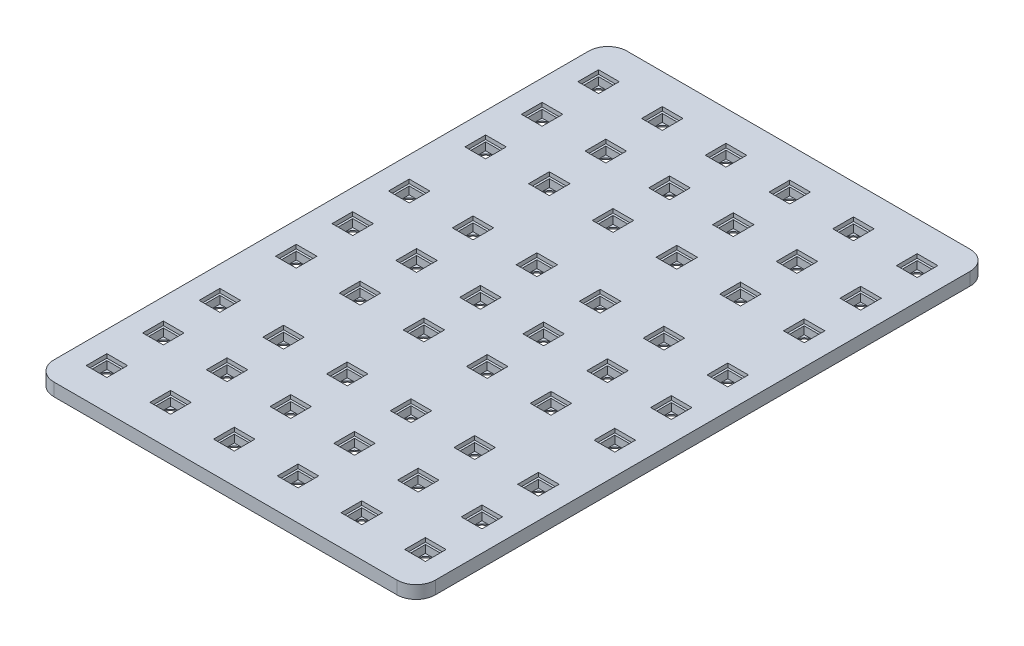
from build123d import *
from build123d.topology import SkipClean

# Parameters (mm, degrees)
SKETCH1_W            = 298.5
SKETCH1_H            = 448.5
BOSS_EXTRUDE1_DEPTH  = 20.1
SKETCH2_W            = 32.4
SKETCH2_H            = 32.4
SKETCH2_W_2          = 26
SKETCH2_H_2          = 26
CUT_EXTRUDE1_DEPTH   = 6.2
SKETCH2_3_W          = 26
SKETCH2_3_H          = 26
SKETCH2_3_R          = 12.5
CUT_EXTRUDE2_DEPTH   = 18.2
SKETCH2_4_R          = 12.5
CUT_EXTRUDE3_DEPTH   = 271.125220962
FILLET1_R            = 30
SHELL1_OUTLINE_W     = 36.4
SHELL1_OUTLINE_H     = 36.4
SHELL1_DEPTH         = 18.1
SHELL1_2_OUTLINE_W   = 36.4
SHELL1_2_OUTLINE_H   = 36.4
SHELL1_2_OUTLINE_W_2 = 30
SHELL1_2_OUTLINE_H_2 = 30
SHELL1_2_DEPTH       = 11.9


# Read off the part's stored shape, not the designer's step: Shell1
with BuildPart() as part:
    # Sketch1 → Boss-Extrude1 (new body)
    with BuildSketch(Plane(origin=(0, 0, 0), x_dir=(1, 0, 0), z_dir=(0, 1, 0))):
        Rectangle(SKETCH1_W, SKETCH1_H)
    extrude(amount=BOSS_EXTRUDE1_DEPTH)

    # Sketch2 → Cut-Extrude1 (cut)
    # profile 1 of 15: a face of its own
    with BuildSketch(Plane(origin=(0, 20.1, 0), x_dir=(1, 0, 0), z_dir=(0, 1, 0))):
        with Locations((-100.05, -160.55)):
            Rectangle(SKETCH2_W, SKETCH2_H)
        with Locations((-100.05, -160.55)):
            Rectangle(SKETCH2_W_2, SKETCH2_H_2, mode=Mode.SUBTRACT)
    # profile 2 of 15: a face of its own
    with BuildSketch(Plane(origin=(0, 20.1, 0), x_dir=(1, 0, 0), z_dir=(0, 1, 0))):
        with Locations((-0.35, -160.55)):
            Rectangle(SKETCH2_W, SKETCH2_H)
        with Locations((-0.35, -160.55)):
            Rectangle(SKETCH2_W_2, SKETCH2_H_2, mode=Mode.SUBTRACT)
    # profile 3 of 15: a face of its own
    with BuildSketch(Plane(origin=(0, 20.1, 0), x_dir=(1, 0, 0), z_dir=(0, 1, 0))):
        with Locations((99.35, -160.55)):
            Rectangle(SKETCH2_W, SKETCH2_H)
        with Locations((99.35, -160.55)):
            Rectangle(SKETCH2_W_2, SKETCH2_H_2, mode=Mode.SUBTRACT)
    # profile 4 of 15: a face of its own
    with BuildSketch(Plane(origin=(0, 20.1, 0), x_dir=(1, 0, 0), z_dir=(0, 1, 0))):
        with Locations((99.35, -72.15)):
            Rectangle(SKETCH2_W, SKETCH2_H)
        with Locations((99.35, -72.15)):
            Rectangle(SKETCH2_W_2, SKETCH2_H_2, mode=Mode.SUBTRACT)
    # profile 5 of 15: a face of its own
    with BuildSketch(Plane(origin=(0, 20.1, 0), x_dir=(1, 0, 0), z_dir=(0, 1, 0))):
        with Locations((-0.35, -72.15)):
            Rectangle(SKETCH2_W, SKETCH2_H)
        with Locations((-0.35, -72.15)):
            Rectangle(SKETCH2_W_2, SKETCH2_H_2, mode=Mode.SUBTRACT)
    # profile 6 of 15: a face of its own
    with BuildSketch(Plane(origin=(0, 20.1, 0), x_dir=(1, 0, 0), z_dir=(0, 1, 0))):
        with Locations((-100.05, -72.15)):
            Rectangle(SKETCH2_W, SKETCH2_H)
        with Locations((-100.05, -72.15)):
            Rectangle(SKETCH2_W_2, SKETCH2_H_2, mode=Mode.SUBTRACT)
    # profile 7 of 15: a face of its own
    with BuildSketch(Plane(origin=(0, 20.1, 0), x_dir=(1, 0, 0), z_dir=(0, 1, 0))):
        with Locations((-100.05, 16.25)):
            Rectangle(SKETCH2_W, SKETCH2_H)
        with Locations((-100.05, 16.25)):
            Rectangle(SKETCH2_W_2, SKETCH2_H_2, mode=Mode.SUBTRACT)
    # profile 8 of 15: a face of its own
    with BuildSketch(Plane(origin=(0, 20.1, 0), x_dir=(1, 0, 0), z_dir=(0, 1, 0))):
        with Locations((-0.35, 16.25)):
            Rectangle(SKETCH2_W, SKETCH2_H)
        with Locations((-0.35, 16.25)):
            Rectangle(SKETCH2_W_2, SKETCH2_H_2, mode=Mode.SUBTRACT)
    # profile 9 of 15: a face of its own
    with BuildSketch(Plane(origin=(0, 20.1, 0), x_dir=(1, 0, 0), z_dir=(0, 1, 0))):
        with Locations((99.35, 16.25)):
            Rectangle(SKETCH2_W, SKETCH2_H)
        with Locations((99.35, 16.25)):
            Rectangle(SKETCH2_W_2, SKETCH2_H_2, mode=Mode.SUBTRACT)
    # profile 10 of 15: a face of its own
    with BuildSketch(Plane(origin=(0, 20.1, 0), x_dir=(1, 0, 0), z_dir=(0, 1, 0))):
        with Locations((99.75, 135.85)):
            Rectangle(SKETCH2_W, SKETCH2_H)
        with Locations((99.75, 135.85)):
            Rectangle(SKETCH2_W_2, SKETCH2_H_2, mode=Mode.SUBTRACT)
    # profile 11 of 15: a face of its own
    with BuildSketch(Plane(origin=(0, 20.1, 0), x_dir=(1, 0, 0), z_dir=(0, 1, 0))):
        with Locations((-0.15, 135.85)):
            Rectangle(SKETCH2_W, SKETCH2_H)
        with Locations((-0.15, 135.85)):
            Rectangle(SKETCH2_W_2, SKETCH2_H_2, mode=Mode.SUBTRACT)
    # profile 12 of 15: a face of its own
    with BuildSketch(Plane(origin=(0, 20.1, 0), x_dir=(1, 0, 0), z_dir=(0, 1, 0))):
        with Locations((-100.05, 135.85)):
            Rectangle(SKETCH2_W, SKETCH2_H)
        with Locations((-100.05, 135.85)):
            Rectangle(SKETCH2_W_2, SKETCH2_H_2, mode=Mode.SUBTRACT)
    # profile 13 of 15: a face of its own
    with BuildSketch(Plane(origin=(0, 20.1, 0), x_dir=(1, 0, 0), z_dir=(0, 1, 0))):
        Polygon((-83.85, 208.05), (-83.85, 224.25), (-87.05, 224.25), (-87.05, 211.25), (-113.05, 211.25), (-113.05, 224.25), (-116.25, 224.25), (-116.25, 208.05), align=None)
    # profile 14 of 15: a face of its own
    with BuildSketch(Plane(origin=(0, 20.1, 0), x_dir=(1, 0, 0), z_dir=(0, 1, 0))):
        Polygon((-13.15, 224.25), (-16.35, 224.25), (-16.35, 208.05), (16.05, 208.05), (16.05, 224.25), (12.85, 224.25), (12.85, 211.25), (-13.15, 211.25), align=None)
    # profile 15 of 15: a face of its own
    with BuildSketch(Plane(origin=(0, 20.1, 0), x_dir=(1, 0, 0), z_dir=(0, 1, 0))):
        Polygon((86.75, 224.25), (83.55, 224.25), (83.55, 208.05), (115.95, 208.05), (115.95, 224.25), (112.75, 224.25), (112.75, 211.25), (86.75, 211.25), align=None)
    extrude(amount=-CUT_EXTRUDE1_DEPTH, mode=Mode.SUBTRACT)

    # Sketch2<3> → Cut-Extrude2 (cut)
    # profile 1 of 15: a face of its own
    with BuildSketch(Plane(origin=(0, 20.1, 0), x_dir=(1, 0, 0), z_dir=(0, 1, 0))):
        with Locations((-100.05, -160.55)):
            Rectangle(SKETCH2_3_W, SKETCH2_3_H)
        with Locations(Location((-100.05, -160.55, 0), (0, 0, 270))):
            Circle(SKETCH2_3_R, mode=Mode.SUBTRACT)
    # profile 2 of 15: a face of its own
    with BuildSketch(Plane(origin=(0, 20.1, 0), x_dir=(1, 0, 0), z_dir=(0, 1, 0))):
        with Locations((-0.35, -160.55)):
            Rectangle(SKETCH2_3_W, SKETCH2_3_H)
        with Locations(Location((-0.35, -160.55, 0), (0, 0, 270))):
            Circle(SKETCH2_3_R, mode=Mode.SUBTRACT)
    # profile 3 of 15: a face of its own
    with BuildSketch(Plane(origin=(0, 20.1, 0), x_dir=(1, 0, 0), z_dir=(0, 1, 0))):
        with Locations((99.35, -160.55)):
            Rectangle(SKETCH2_3_W, SKETCH2_3_H)
        with Locations(Location((99.35, -160.55, 0), (0, 0, 270))):
            Circle(SKETCH2_3_R, mode=Mode.SUBTRACT)
    # profile 4 of 15: a face of its own
    with BuildSketch(Plane(origin=(0, 20.1, 0), x_dir=(1, 0, 0), z_dir=(0, 1, 0))):
        with Locations((99.35, -72.15)):
            Rectangle(SKETCH2_3_W, SKETCH2_3_H)
        with Locations(Location((99.35, -72.15, 0), (0, 0, 270))):
            Circle(SKETCH2_3_R, mode=Mode.SUBTRACT)
    # profile 5 of 15: a face of its own
    with BuildSketch(Plane(origin=(0, 20.1, 0), x_dir=(1, 0, 0), z_dir=(0, 1, 0))):
        with Locations((-0.35, -72.15)):
            Rectangle(SKETCH2_3_W, SKETCH2_3_H)
        with Locations(Location((-0.35, -72.15, 0), (0, 0, 270))):
            Circle(SKETCH2_3_R, mode=Mode.SUBTRACT)
    # profile 6 of 15: a face of its own
    with BuildSketch(Plane(origin=(0, 20.1, 0), x_dir=(1, 0, 0), z_dir=(0, 1, 0))):
        with Locations((-100.05, -72.15)):
            Rectangle(SKETCH2_3_W, SKETCH2_3_H)
        with Locations(Location((-100.05, -72.15, 0), (0, 0, 270))):
            Circle(SKETCH2_3_R, mode=Mode.SUBTRACT)
    # profile 7 of 15: a face of its own
    with BuildSketch(Plane(origin=(0, 20.1, 0), x_dir=(1, 0, 0), z_dir=(0, 1, 0))):
        with Locations((-100.05, 135.85)):
            Rectangle(SKETCH2_3_W, SKETCH2_3_H)
        with Locations(Location((-100.05, 135.85, 0), (0, 0, 270))):
            Circle(SKETCH2_3_R, mode=Mode.SUBTRACT)
    # profile 8 of 15: a face of its own
    with BuildSketch(Plane(origin=(0, 20.1, 0), x_dir=(1, 0, 0), z_dir=(0, 1, 0))):
        with BuildLine():
            Line((-87.05, 211.25), (-87.05, 224.25))
            Line((-87.05, 224.25), (-87.55, 224.25))
            ThreePointArc((-87.55, 224.25), (-100.05, 211.75), (-112.55, 224.25))
            Line((-112.55, 224.25), (-113.05, 224.25))
            Line((-113.05, 224.25), (-113.05, 211.25))
            Line((-113.05, 211.25), (-87.05, 211.25))
        make_face()
    # profile 9 of 15: a face of its own
    with BuildSketch(Plane(origin=(0, 20.1, 0), x_dir=(1, 0, 0), z_dir=(0, 1, 0))):
        with BuildLine():
            Line((-12.65, 224.25), (-13.15, 224.25))
            Line((-13.15, 224.25), (-13.15, 211.25))
            Line((-13.15, 211.25), (12.85, 211.25))
            Line((12.85, 211.25), (12.85, 224.25))
            Line((12.85, 224.25), (12.35, 224.25))
            ThreePointArc((12.35, 224.25), (-0.15, 211.75), (-12.65, 224.25))
        make_face()
    # profile 10 of 15: a face of its own
    with BuildSketch(Plane(origin=(0, 20.1, 0), x_dir=(1, 0, 0), z_dir=(0, 1, 0))):
        with Locations((-0.15, 135.85)):
            Rectangle(SKETCH2_3_W, SKETCH2_3_H)
        with Locations(Location((-0.15, 135.85, 0), (0, 0, 270))):
            Circle(SKETCH2_3_R, mode=Mode.SUBTRACT)
    # profile 11 of 15: a face of its own
    with BuildSketch(Plane(origin=(0, 20.1, 0), x_dir=(1, 0, 0), z_dir=(0, 1, 0))):
        with Locations((99.75, 135.85)):
            Rectangle(SKETCH2_3_W, SKETCH2_3_H)
        with Locations(Location((99.75, 135.85, 0), (0, 0, 270))):
            Circle(SKETCH2_3_R, mode=Mode.SUBTRACT)
    # profile 12 of 15: a face of its own
    with BuildSketch(Plane(origin=(0, 20.1, 0), x_dir=(1, 0, 0), z_dir=(0, 1, 0))):
        with BuildLine():
            Line((87.25, 224.25), (86.75, 224.25))
            Line((86.75, 224.25), (86.75, 211.25))
            Line((86.75, 211.25), (112.75, 211.25))
            Line((112.75, 211.25), (112.75, 224.25))
            Line((112.75, 224.25), (112.25, 224.25))
            ThreePointArc((112.25, 224.25), (99.75, 211.75), (87.25, 224.25))
        make_face()
    # profile 13 of 15: a face of its own
    with BuildSketch(Plane(origin=(0, 20.1, 0), x_dir=(1, 0, 0), z_dir=(0, 1, 0))):
        with Locations((99.35, 16.25)):
            Rectangle(SKETCH2_3_W, SKETCH2_3_H)
        with Locations(Location((99.35, 16.25, 0), (0, 0, 270))):
            Circle(SKETCH2_3_R, mode=Mode.SUBTRACT)
    # profile 14 of 15: a face of its own
    with BuildSketch(Plane(origin=(0, 20.1, 0), x_dir=(1, 0, 0), z_dir=(0, 1, 0))):
        with Locations((-0.35, 16.25)):
            Rectangle(SKETCH2_3_W, SKETCH2_3_H)
        with Locations(Location((-0.35, 16.25, 0), (0, 0, 270))):
            Circle(SKETCH2_3_R, mode=Mode.SUBTRACT)
    # profile 15 of 15: a face of its own
    with BuildSketch(Plane(origin=(0, 20.1, 0), x_dir=(1, 0, 0), z_dir=(0, 1, 0))):
        with Locations((-100.05, 16.25)):
            Rectangle(SKETCH2_3_W, SKETCH2_3_H)
        with Locations(Location((-100.05, 16.25, 0), (0, 0, 270))):
            Circle(SKETCH2_3_R, mode=Mode.SUBTRACT)
    extrude(amount=-CUT_EXTRUDE2_DEPTH, mode=Mode.SUBTRACT)

    # Sketch2<4> → Cut-Extrude3 (cut, through all)
    with BuildSketch(Plane(origin=(0, 20.1, 0), x_dir=(1, 0, 0), z_dir=(0, 1, 0))):
        with Locations(Location((-100.05, -160.55, 0), (0, 0, 270))):
            Circle(SKETCH2_4_R)
        with Locations(Location((-0.35, -160.55, 0), (0, 0, 270))):
            Circle(SKETCH2_4_R)
        with Locations(Location((99.35, -160.55, 0), (0, 0, 270))):
            Circle(SKETCH2_4_R)
        with Locations(Location((99.35, -72.15, 0), (0, 0, 270))):
            Circle(SKETCH2_4_R)
        with Locations(Location((-0.35, -72.15, 0), (0, 0, 270))):
            Circle(SKETCH2_4_R)
        with Locations(Location((-100.05, -72.15, 0), (0, 0, 270))):
            Circle(SKETCH2_4_R)
        with Locations(Location((-100.05, 16.25, 0), (0, 0, 270))):
            Circle(SKETCH2_4_R)
        with Locations(Location((-0.35, 16.25, 0), (0, 0, 270))):
            Circle(SKETCH2_4_R)
        with Locations(Location((99.35, 16.25, 0), (0, 0, 270))):
            Circle(SKETCH2_4_R)
        with Locations(Location((99.75, 135.85, 0), (0, 0, 270))):
            Circle(SKETCH2_4_R)
        with Locations(Location((-0.15, 135.85, 0), (0, 0, 270))):
            Circle(SKETCH2_4_R)
        with Locations(Location((-100.05, 135.85, 0), (0, 0, 270))):
            Circle(SKETCH2_4_R)
        with BuildLine():
            Line((-112.55, 224.25), (-87.55, 224.25))
            ThreePointArc((-87.55, 224.25), (-100.05, 236.75), (-112.55, 224.25))
        make_face()
        with BuildLine():
            ThreePointArc((-112.55, 224.25), (-100.05, 211.75), (-87.55, 224.25))
            Line((-87.55, 224.25), (-112.55, 224.25))
        make_face()
        with BuildLine():
            Line((12.35, 224.25), (-12.65, 224.25))
            ThreePointArc((-12.65, 224.25), (-0.15, 211.75), (12.35, 224.25))
        make_face()
        with BuildLine():
            ThreePointArc((12.35, 224.25), (-0.15, 236.75), (-12.65, 224.25))
            Line((-12.65, 224.25), (12.35, 224.25))
        make_face()
        with BuildLine():
            Line((112.25, 224.25), (87.25, 224.25))
            ThreePointArc((87.25, 224.25), (99.75, 211.75), (112.25, 224.25))
        make_face()
        with BuildLine():
            ThreePointArc((112.25, 224.25), (99.75, 236.75), (87.25, 224.25))
            Line((87.25, 224.25), (112.25, 224.25))
        make_face()
    extrude(amount=-CUT_EXTRUDE3_DEPTH, mode=Mode.SUBTRACT)

    # Fillet1
    fillet1_edges = [part.edges().sort_by_distance(p)[0] for p in [
        (-149.25, 10.05, 224.25),
    ]]
    fillet(fillet1_edges, radius=FILLET1_R)

    # Mirror1: part across plane


with BuildPart() as part_1:
    add(part.part)
    add(part.part.mirror(Plane(origin=(149.25, 20.1, 224.25), x_dir=(0, 0, 1), z_dir=(-1, 0, 0))))

    # Mirror2: part across plane


with BuildPart() as part_2:
    with SkipClean():  # the faces are left unmerged after this step: merging them gives an invalid solid
        add(part_1.part)
        add(part_1.part.mirror(Plane(origin=(-149.25, 20.1, -224.25), x_dir=(1, 0, 0), z_dir=(0, 0, 1))))

    # Shell1 outline → Shell1 (cut)
    with SkipClean():  # the faces are left unmerged after this step: merging them gives an invalid solid
        with BuildSketch(Plane(origin=(0, 0, 0), x_dir=(1, 0, 0), z_dir=(0, 1, 0))):
            with BuildLine():
                Line((-147.25, 642.75), (-147.25, -194.25))
                ThreePointArc((-147.25, -194.25), (-139.048989873, -214.048989873), (-119.25, -222.25))
                Line((-119.25, -222.25), (417.75, -222.25))
                ThreePointArc((417.75, -222.25), (437.548989873, -214.048989873), (445.75, -194.25))
                Line((445.75, -194.25), (445.75, 642.75))
                ThreePointArc((445.75, 642.75), (437.548989873, 662.548989873), (417.75, 670.75))
                Line((417.75, 670.75), (-119.25, 670.75))
                ThreePointArc((-119.25, 670.75), (-139.048989873, 662.548989873), (-147.25, 642.75))
            make_face()
            with Locations((-100.05, -160.55)):
                Rectangle(SHELL1_OUTLINE_W, SHELL1_OUTLINE_H, mode=Mode.SUBTRACT)
            with Locations((-0.35, -160.55)):
                Rectangle(SHELL1_OUTLINE_W, SHELL1_OUTLINE_H, mode=Mode.SUBTRACT)
            with Locations((-100.05, -72.15)):
                Rectangle(SHELL1_OUTLINE_W, SHELL1_OUTLINE_H, mode=Mode.SUBTRACT)
            with Locations((-0.35, -72.15)):
                Rectangle(SHELL1_OUTLINE_W, SHELL1_OUTLINE_H, mode=Mode.SUBTRACT)
            with Locations((99.35, -160.55)):
                Rectangle(SHELL1_OUTLINE_W, SHELL1_OUTLINE_H, mode=Mode.SUBTRACT)
            with Locations((99.35, -72.15)):
                Rectangle(SHELL1_OUTLINE_W, SHELL1_OUTLINE_H, mode=Mode.SUBTRACT)
            with Locations((-100.05, 16.25)):
                Rectangle(SHELL1_OUTLINE_W, SHELL1_OUTLINE_H, mode=Mode.SUBTRACT)
            with Locations((-0.35, 16.25)):
                Rectangle(SHELL1_OUTLINE_W, SHELL1_OUTLINE_H, mode=Mode.SUBTRACT)
            with Locations((-100.05, 135.85)):
                Rectangle(SHELL1_OUTLINE_W, SHELL1_OUTLINE_H, mode=Mode.SUBTRACT)
            with Locations((-0.15, 135.85)):
                Rectangle(SHELL1_OUTLINE_W, SHELL1_OUTLINE_H, mode=Mode.SUBTRACT)
            with Locations((99.35, 16.25)):
                Rectangle(SHELL1_OUTLINE_W, SHELL1_OUTLINE_H, mode=Mode.SUBTRACT)
            with Locations((99.75, 135.85)):
                Rectangle(SHELL1_OUTLINE_W, SHELL1_OUTLINE_H, mode=Mode.SUBTRACT)
            with Locations((199.15, -160.55)):
                Rectangle(SHELL1_OUTLINE_W, SHELL1_OUTLINE_H, mode=Mode.SUBTRACT)
            with Locations((199.15, -72.15)):
                Rectangle(SHELL1_OUTLINE_W, SHELL1_OUTLINE_H, mode=Mode.SUBTRACT)
            with Locations((298.85, -160.55)):
                Rectangle(SHELL1_OUTLINE_W, SHELL1_OUTLINE_H, mode=Mode.SUBTRACT)
            with Locations((398.55, -160.55)):
                Rectangle(SHELL1_OUTLINE_W, SHELL1_OUTLINE_H, mode=Mode.SUBTRACT)
            with Locations((298.85, -72.15)):
                Rectangle(SHELL1_OUTLINE_W, SHELL1_OUTLINE_H, mode=Mode.SUBTRACT)
            with Locations((398.55, -72.15)):
                Rectangle(SHELL1_OUTLINE_W, SHELL1_OUTLINE_H, mode=Mode.SUBTRACT)
            with Locations((199.15, 16.25)):
                Rectangle(SHELL1_OUTLINE_W, SHELL1_OUTLINE_H, mode=Mode.SUBTRACT)
            with Locations((198.75, 135.85)):
                Rectangle(SHELL1_OUTLINE_W, SHELL1_OUTLINE_H, mode=Mode.SUBTRACT)
            with Locations((298.85, 16.25)):
                Rectangle(SHELL1_OUTLINE_W, SHELL1_OUTLINE_H, mode=Mode.SUBTRACT)
            with Locations((398.55, 16.25)):
                Rectangle(SHELL1_OUTLINE_W, SHELL1_OUTLINE_H, mode=Mode.SUBTRACT)
            with Locations((298.65, 135.85)):
                Rectangle(SHELL1_OUTLINE_W, SHELL1_OUTLINE_H, mode=Mode.SUBTRACT)
            with Locations((398.55, 135.85)):
                Rectangle(SHELL1_OUTLINE_W, SHELL1_OUTLINE_H, mode=Mode.SUBTRACT)
            with Locations((-100.05, 224.25)):
                Rectangle(SHELL1_OUTLINE_W, SHELL1_OUTLINE_H, mode=Mode.SUBTRACT)
            with Locations((-100.05, 312.65)):
                Rectangle(SHELL1_OUTLINE_W, SHELL1_OUTLINE_H, mode=Mode.SUBTRACT)
            with Locations((-0.15, 224.25)):
                Rectangle(SHELL1_OUTLINE_W, SHELL1_OUTLINE_H, mode=Mode.SUBTRACT)
            with Locations((-0.15, 312.65)):
                Rectangle(SHELL1_OUTLINE_W, SHELL1_OUTLINE_H, mode=Mode.SUBTRACT)
            with Locations((-100.05, 432.25)):
                Rectangle(SHELL1_OUTLINE_W, SHELL1_OUTLINE_H, mode=Mode.SUBTRACT)
            with Locations((-0.35, 432.25)):
                Rectangle(SHELL1_OUTLINE_W, SHELL1_OUTLINE_H, mode=Mode.SUBTRACT)
            with Locations((99.75, 224.25)):
                Rectangle(SHELL1_OUTLINE_W, SHELL1_OUTLINE_H, mode=Mode.SUBTRACT)
            with Locations((99.75, 312.65)):
                Rectangle(SHELL1_OUTLINE_W, SHELL1_OUTLINE_H, mode=Mode.SUBTRACT)
            with Locations((99.35, 432.25)):
                Rectangle(SHELL1_OUTLINE_W, SHELL1_OUTLINE_H, mode=Mode.SUBTRACT)
            with Locations((-100.05, 520.65)):
                Rectangle(SHELL1_OUTLINE_W, SHELL1_OUTLINE_H, mode=Mode.SUBTRACT)
            with Locations((-0.35, 520.65)):
                Rectangle(SHELL1_OUTLINE_W, SHELL1_OUTLINE_H, mode=Mode.SUBTRACT)
            with Locations((-100.05, 609.05)):
                Rectangle(SHELL1_OUTLINE_W, SHELL1_OUTLINE_H, mode=Mode.SUBTRACT)
            with Locations((-0.35, 609.05)):
                Rectangle(SHELL1_OUTLINE_W, SHELL1_OUTLINE_H, mode=Mode.SUBTRACT)
            with Locations((99.35, 520.65)):
                Rectangle(SHELL1_OUTLINE_W, SHELL1_OUTLINE_H, mode=Mode.SUBTRACT)
            with Locations((99.35, 609.05)):
                Rectangle(SHELL1_OUTLINE_W, SHELL1_OUTLINE_H, mode=Mode.SUBTRACT)
            with Locations((198.75, 224.25)):
                Rectangle(SHELL1_OUTLINE_W, SHELL1_OUTLINE_H, mode=Mode.SUBTRACT)
            with Locations((198.75, 312.65)):
                Rectangle(SHELL1_OUTLINE_W, SHELL1_OUTLINE_H, mode=Mode.SUBTRACT)
            with Locations((199.15, 432.25)):
                Rectangle(SHELL1_OUTLINE_W, SHELL1_OUTLINE_H, mode=Mode.SUBTRACT)
            with Locations((298.65, 224.25)):
                Rectangle(SHELL1_OUTLINE_W, SHELL1_OUTLINE_H, mode=Mode.SUBTRACT)
            with Locations((298.65, 312.65)):
                Rectangle(SHELL1_OUTLINE_W, SHELL1_OUTLINE_H, mode=Mode.SUBTRACT)
            with Locations((398.55, 224.25)):
                Rectangle(SHELL1_OUTLINE_W, SHELL1_OUTLINE_H, mode=Mode.SUBTRACT)
            with Locations((398.55, 312.65)):
                Rectangle(SHELL1_OUTLINE_W, SHELL1_OUTLINE_H, mode=Mode.SUBTRACT)
            with Locations((298.85, 432.25)):
                Rectangle(SHELL1_OUTLINE_W, SHELL1_OUTLINE_H, mode=Mode.SUBTRACT)
            with Locations((398.55, 432.25)):
                Rectangle(SHELL1_OUTLINE_W, SHELL1_OUTLINE_H, mode=Mode.SUBTRACT)
            with Locations((199.15, 520.65)):
                Rectangle(SHELL1_OUTLINE_W, SHELL1_OUTLINE_H, mode=Mode.SUBTRACT)
            with Locations((199.15, 609.05)):
                Rectangle(SHELL1_OUTLINE_W, SHELL1_OUTLINE_H, mode=Mode.SUBTRACT)
            with Locations((298.85, 520.65)):
                Rectangle(SHELL1_OUTLINE_W, SHELL1_OUTLINE_H, mode=Mode.SUBTRACT)
            with Locations((398.55, 520.65)):
                Rectangle(SHELL1_OUTLINE_W, SHELL1_OUTLINE_H, mode=Mode.SUBTRACT)
            with Locations((298.85, 609.05)):
                Rectangle(SHELL1_OUTLINE_W, SHELL1_OUTLINE_H, mode=Mode.SUBTRACT)
            with Locations((398.55, 609.05)):
                Rectangle(SHELL1_OUTLINE_W, SHELL1_OUTLINE_H, mode=Mode.SUBTRACT)
        extrude(amount=SHELL1_DEPTH, mode=Mode.SUBTRACT)

    # Shell1 2 outline → Shell1 2 (cut)
    # profile 1 of 54: a face of its own
    with SkipClean():  # the faces are left unmerged after this step: merging them gives an invalid solid
        with BuildSketch(Plane(origin=(0, 0, 0), x_dir=(1, 0, 0), z_dir=(0, 1, 0))):
            with Locations((-100.05, -160.55)):
                Rectangle(SHELL1_2_OUTLINE_W, SHELL1_2_OUTLINE_H)
            with Locations((-100.05, -160.55)):
                Rectangle(SHELL1_2_OUTLINE_W_2, SHELL1_2_OUTLINE_H_2, mode=Mode.SUBTRACT)
        # profile 2 of 54: a face of its own
        with BuildSketch(Plane(origin=(0, 0, 0), x_dir=(1, 0, 0), z_dir=(0, 1, 0))):
            with Locations((99.35, -160.55)):
                Rectangle(SHELL1_2_OUTLINE_W, SHELL1_2_OUTLINE_H)
            with Locations((99.35, -160.55)):
                Rectangle(SHELL1_2_OUTLINE_W_2, SHELL1_2_OUTLINE_H_2, mode=Mode.SUBTRACT)
        # profile 3 of 54: a face of its own
        with BuildSketch(Plane(origin=(0, 0, 0), x_dir=(1, 0, 0), z_dir=(0, 1, 0))):
            with Locations((-0.35, -160.55)):
                Rectangle(SHELL1_2_OUTLINE_W, SHELL1_2_OUTLINE_H)
            with Locations((-0.35, -160.55)):
                Rectangle(SHELL1_2_OUTLINE_W_2, SHELL1_2_OUTLINE_H_2, mode=Mode.SUBTRACT)
        # profile 4 of 54: a face of its own
        with BuildSketch(Plane(origin=(0, 0, 0), x_dir=(1, 0, 0), z_dir=(0, 1, 0))):
            with Locations((398.55, -160.55)):
                Rectangle(SHELL1_2_OUTLINE_W, SHELL1_2_OUTLINE_H)
            with Locations((398.55, -160.55)):
                Rectangle(SHELL1_2_OUTLINE_W_2, SHELL1_2_OUTLINE_H_2, mode=Mode.SUBTRACT)
        # profile 5 of 54: a face of its own
        with BuildSketch(Plane(origin=(0, 0, 0), x_dir=(1, 0, 0), z_dir=(0, 1, 0))):
            with Locations((199.15, -160.55)):
                Rectangle(SHELL1_2_OUTLINE_W, SHELL1_2_OUTLINE_H)
            with Locations((199.15, -160.55)):
                Rectangle(SHELL1_2_OUTLINE_W_2, SHELL1_2_OUTLINE_H_2, mode=Mode.SUBTRACT)
        # profile 6 of 54: a face of its own
        with BuildSketch(Plane(origin=(0, 0, 0), x_dir=(1, 0, 0), z_dir=(0, 1, 0))):
            with Locations((298.85, -160.55)):
                Rectangle(SHELL1_2_OUTLINE_W, SHELL1_2_OUTLINE_H)
            with Locations((298.85, -160.55)):
                Rectangle(SHELL1_2_OUTLINE_W_2, SHELL1_2_OUTLINE_H_2, mode=Mode.SUBTRACT)
        # profile 7 of 54: a face of its own
        with BuildSketch(Plane(origin=(0, 0, 0), x_dir=(1, 0, 0), z_dir=(0, 1, 0))):
            with Locations((-100.05, 16.25)):
                Rectangle(SHELL1_2_OUTLINE_W, SHELL1_2_OUTLINE_H)
            with Locations((-100.05, 16.25)):
                Rectangle(SHELL1_2_OUTLINE_W_2, SHELL1_2_OUTLINE_H_2, mode=Mode.SUBTRACT)
        # profile 8 of 54: a face of its own
        with BuildSketch(Plane(origin=(0, 0, 0), x_dir=(1, 0, 0), z_dir=(0, 1, 0))):
            with Locations((-100.05, -72.15)):
                Rectangle(SHELL1_2_OUTLINE_W, SHELL1_2_OUTLINE_H)
            with Locations((-100.05, -72.15)):
                Rectangle(SHELL1_2_OUTLINE_W_2, SHELL1_2_OUTLINE_H_2, mode=Mode.SUBTRACT)
        # profile 9 of 54: a face of its own
        with BuildSketch(Plane(origin=(0, 0, 0), x_dir=(1, 0, 0), z_dir=(0, 1, 0))):
            with Locations((-100.05, 224.25)):
                Rectangle(SHELL1_2_OUTLINE_W, SHELL1_2_OUTLINE_H)
            with Locations((-100.05, 224.25)):
                Rectangle(SHELL1_2_OUTLINE_W_2, SHELL1_2_OUTLINE_H_2, mode=Mode.SUBTRACT)
        # profile 10 of 54: a face of its own
        with BuildSketch(Plane(origin=(0, 0, 0), x_dir=(1, 0, 0), z_dir=(0, 1, 0))):
            with Locations((-100.05, 135.85)):
                Rectangle(SHELL1_2_OUTLINE_W, SHELL1_2_OUTLINE_H)
            with Locations((-100.05, 135.85)):
                Rectangle(SHELL1_2_OUTLINE_W_2, SHELL1_2_OUTLINE_H_2, mode=Mode.SUBTRACT)
        # profile 11 of 54: a face of its own
        with BuildSketch(Plane(origin=(0, 0, 0), x_dir=(1, 0, 0), z_dir=(0, 1, 0))):
            with Locations((-100.05, 609.05)):
                Rectangle(SHELL1_2_OUTLINE_W, SHELL1_2_OUTLINE_H)
            with Locations((-100.05, 609.05)):
                Rectangle(SHELL1_2_OUTLINE_W_2, SHELL1_2_OUTLINE_H_2, mode=Mode.SUBTRACT)
        # profile 12 of 54: a face of its own
        with BuildSketch(Plane(origin=(0, 0, 0), x_dir=(1, 0, 0), z_dir=(0, 1, 0))):
            with Locations((-100.05, 432.25)):
                Rectangle(SHELL1_2_OUTLINE_W, SHELL1_2_OUTLINE_H)
            with Locations((-100.05, 432.25)):
                Rectangle(SHELL1_2_OUTLINE_W_2, SHELL1_2_OUTLINE_H_2, mode=Mode.SUBTRACT)
        # profile 13 of 54: a face of its own
        with BuildSketch(Plane(origin=(0, 0, 0), x_dir=(1, 0, 0), z_dir=(0, 1, 0))):
            with Locations((-100.05, 520.65)):
                Rectangle(SHELL1_2_OUTLINE_W, SHELL1_2_OUTLINE_H)
            with Locations((-100.05, 520.65)):
                Rectangle(SHELL1_2_OUTLINE_W_2, SHELL1_2_OUTLINE_H_2, mode=Mode.SUBTRACT)
        # profile 14 of 54: a face of its own
        with BuildSketch(Plane(origin=(0, 0, 0), x_dir=(1, 0, 0), z_dir=(0, 1, 0))):
            with Locations((-100.05, 312.65)):
                Rectangle(SHELL1_2_OUTLINE_W, SHELL1_2_OUTLINE_H)
            with Locations((-100.05, 312.65)):
                Rectangle(SHELL1_2_OUTLINE_W_2, SHELL1_2_OUTLINE_H_2, mode=Mode.SUBTRACT)
        # profile 15 of 54: a face of its own
        with BuildSketch(Plane(origin=(0, 0, 0), x_dir=(1, 0, 0), z_dir=(0, 1, 0))):
            with Locations((99.35, 16.25)):
                Rectangle(SHELL1_2_OUTLINE_W, SHELL1_2_OUTLINE_H)
            with Locations((99.35, 16.25)):
                Rectangle(SHELL1_2_OUTLINE_W_2, SHELL1_2_OUTLINE_H_2, mode=Mode.SUBTRACT)
        # profile 16 of 54: a face of its own
        with BuildSketch(Plane(origin=(0, 0, 0), x_dir=(1, 0, 0), z_dir=(0, 1, 0))):
            with Locations((99.35, -72.15)):
                Rectangle(SHELL1_2_OUTLINE_W, SHELL1_2_OUTLINE_H)
            with Locations((99.35, -72.15)):
                Rectangle(SHELL1_2_OUTLINE_W_2, SHELL1_2_OUTLINE_H_2, mode=Mode.SUBTRACT)
        # profile 17 of 54: a face of its own
        with BuildSketch(Plane(origin=(0, 0, 0), x_dir=(1, 0, 0), z_dir=(0, 1, 0))):
            with Locations((99.35, 432.25)):
                Rectangle(SHELL1_2_OUTLINE_W, SHELL1_2_OUTLINE_H)
            with Locations((99.35, 432.25)):
                Rectangle(SHELL1_2_OUTLINE_W_2, SHELL1_2_OUTLINE_H_2, mode=Mode.SUBTRACT)
        # profile 18 of 54: a face of its own
        with BuildSketch(Plane(origin=(0, 0, 0), x_dir=(1, 0, 0), z_dir=(0, 1, 0))):
            with Locations((99.35, 520.65)):
                Rectangle(SHELL1_2_OUTLINE_W, SHELL1_2_OUTLINE_H)
            with Locations((99.35, 520.65)):
                Rectangle(SHELL1_2_OUTLINE_W_2, SHELL1_2_OUTLINE_H_2, mode=Mode.SUBTRACT)
        # profile 19 of 54: a face of its own
        with BuildSketch(Plane(origin=(0, 0, 0), x_dir=(1, 0, 0), z_dir=(0, 1, 0))):
            with Locations((99.35, 609.05)):
                Rectangle(SHELL1_2_OUTLINE_W, SHELL1_2_OUTLINE_H)
            with Locations((99.35, 609.05)):
                Rectangle(SHELL1_2_OUTLINE_W_2, SHELL1_2_OUTLINE_H_2, mode=Mode.SUBTRACT)
        # profile 20 of 54: a face of its own
        with BuildSketch(Plane(origin=(0, 0, 0), x_dir=(1, 0, 0), z_dir=(0, 1, 0))):
            with Locations((-0.35, 16.25)):
                Rectangle(SHELL1_2_OUTLINE_W, SHELL1_2_OUTLINE_H)
            with Locations((-0.35, 16.25)):
                Rectangle(SHELL1_2_OUTLINE_W_2, SHELL1_2_OUTLINE_H_2, mode=Mode.SUBTRACT)
        # profile 21 of 54: a face of its own
        with BuildSketch(Plane(origin=(0, 0, 0), x_dir=(1, 0, 0), z_dir=(0, 1, 0))):
            with Locations((199.15, 16.25)):
                Rectangle(SHELL1_2_OUTLINE_W, SHELL1_2_OUTLINE_H)
            with Locations((199.15, 16.25)):
                Rectangle(SHELL1_2_OUTLINE_W_2, SHELL1_2_OUTLINE_H_2, mode=Mode.SUBTRACT)
        # profile 22 of 54: a face of its own
        with BuildSketch(Plane(origin=(0, 0, 0), x_dir=(1, 0, 0), z_dir=(0, 1, 0))):
            with Locations((298.85, 16.25)):
                Rectangle(SHELL1_2_OUTLINE_W, SHELL1_2_OUTLINE_H)
            with Locations((298.85, 16.25)):
                Rectangle(SHELL1_2_OUTLINE_W_2, SHELL1_2_OUTLINE_H_2, mode=Mode.SUBTRACT)
        # profile 23 of 54: a face of its own
        with BuildSketch(Plane(origin=(0, 0, 0), x_dir=(1, 0, 0), z_dir=(0, 1, 0))):
            with Locations((398.55, 16.25)):
                Rectangle(SHELL1_2_OUTLINE_W, SHELL1_2_OUTLINE_H)
            with Locations((398.55, 16.25)):
                Rectangle(SHELL1_2_OUTLINE_W_2, SHELL1_2_OUTLINE_H_2, mode=Mode.SUBTRACT)
        # profile 24 of 54: a face of its own
        with BuildSketch(Plane(origin=(0, 0, 0), x_dir=(1, 0, 0), z_dir=(0, 1, 0))):
            with Locations((-0.35, -72.15)):
                Rectangle(SHELL1_2_OUTLINE_W, SHELL1_2_OUTLINE_H)
            with Locations((-0.35, -72.15)):
                Rectangle(SHELL1_2_OUTLINE_W_2, SHELL1_2_OUTLINE_H_2, mode=Mode.SUBTRACT)
        # profile 25 of 54: a face of its own
        with BuildSketch(Plane(origin=(0, 0, 0), x_dir=(1, 0, 0), z_dir=(0, 1, 0))):
            with Locations((-0.35, 432.25)):
                Rectangle(SHELL1_2_OUTLINE_W, SHELL1_2_OUTLINE_H)
            with Locations((-0.35, 432.25)):
                Rectangle(SHELL1_2_OUTLINE_W_2, SHELL1_2_OUTLINE_H_2, mode=Mode.SUBTRACT)
        # profile 26 of 54: a face of its own
        with BuildSketch(Plane(origin=(0, 0, 0), x_dir=(1, 0, 0), z_dir=(0, 1, 0))):
            with Locations((-0.35, 520.65)):
                Rectangle(SHELL1_2_OUTLINE_W, SHELL1_2_OUTLINE_H)
            with Locations((-0.35, 520.65)):
                Rectangle(SHELL1_2_OUTLINE_W_2, SHELL1_2_OUTLINE_H_2, mode=Mode.SUBTRACT)
        # profile 27 of 54: a face of its own
        with BuildSketch(Plane(origin=(0, 0, 0), x_dir=(1, 0, 0), z_dir=(0, 1, 0))):
            with Locations((-0.35, 609.05)):
                Rectangle(SHELL1_2_OUTLINE_W, SHELL1_2_OUTLINE_H)
            with Locations((-0.35, 609.05)):
                Rectangle(SHELL1_2_OUTLINE_W_2, SHELL1_2_OUTLINE_H_2, mode=Mode.SUBTRACT)
        # profile 28 of 54: a face of its own
        with BuildSketch(Plane(origin=(0, 0, 0), x_dir=(1, 0, 0), z_dir=(0, 1, 0))):
            with Locations((398.55, -72.15)):
                Rectangle(SHELL1_2_OUTLINE_W, SHELL1_2_OUTLINE_H)
            with Locations((398.55, -72.15)):
                Rectangle(SHELL1_2_OUTLINE_W_2, SHELL1_2_OUTLINE_H_2, mode=Mode.SUBTRACT)
        # profile 29 of 54: a face of its own
        with BuildSketch(Plane(origin=(0, 0, 0), x_dir=(1, 0, 0), z_dir=(0, 1, 0))):
            with Locations((298.85, -72.15)):
                Rectangle(SHELL1_2_OUTLINE_W, SHELL1_2_OUTLINE_H)
            with Locations((298.85, -72.15)):
                Rectangle(SHELL1_2_OUTLINE_W_2, SHELL1_2_OUTLINE_H_2, mode=Mode.SUBTRACT)
        # profile 30 of 54: a face of its own
        with BuildSketch(Plane(origin=(0, 0, 0), x_dir=(1, 0, 0), z_dir=(0, 1, 0))):
            with Locations((199.15, -72.15)):
                Rectangle(SHELL1_2_OUTLINE_W, SHELL1_2_OUTLINE_H)
            with Locations((199.15, -72.15)):
                Rectangle(SHELL1_2_OUTLINE_W_2, SHELL1_2_OUTLINE_H_2, mode=Mode.SUBTRACT)
        # profile 31 of 54: a face of its own
        with BuildSketch(Plane(origin=(0, 0, 0), x_dir=(1, 0, 0), z_dir=(0, 1, 0))):
            with Locations((99.75, 224.25)):
                Rectangle(SHELL1_2_OUTLINE_W, SHELL1_2_OUTLINE_H)
            with Locations((99.75, 224.25)):
                Rectangle(SHELL1_2_OUTLINE_W_2, SHELL1_2_OUTLINE_H_2, mode=Mode.SUBTRACT)
        # profile 32 of 54: a face of its own
        with BuildSketch(Plane(origin=(0, 0, 0), x_dir=(1, 0, 0), z_dir=(0, 1, 0))):
            with Locations((99.75, 135.85)):
                Rectangle(SHELL1_2_OUTLINE_W, SHELL1_2_OUTLINE_H)
            with Locations((99.75, 135.85)):
                Rectangle(SHELL1_2_OUTLINE_W_2, SHELL1_2_OUTLINE_H_2, mode=Mode.SUBTRACT)
        # profile 33 of 54: a face of its own
        with BuildSketch(Plane(origin=(0, 0, 0), x_dir=(1, 0, 0), z_dir=(0, 1, 0))):
            with Locations((99.75, 312.65)):
                Rectangle(SHELL1_2_OUTLINE_W, SHELL1_2_OUTLINE_H)
            with Locations((99.75, 312.65)):
                Rectangle(SHELL1_2_OUTLINE_W_2, SHELL1_2_OUTLINE_H_2, mode=Mode.SUBTRACT)
        # profile 34 of 54: a face of its own
        with BuildSketch(Plane(origin=(0, 0, 0), x_dir=(1, 0, 0), z_dir=(0, 1, 0))):
            with Locations((-0.15, 224.25)):
                Rectangle(SHELL1_2_OUTLINE_W, SHELL1_2_OUTLINE_H)
            with Locations((-0.15, 224.25)):
                Rectangle(SHELL1_2_OUTLINE_W_2, SHELL1_2_OUTLINE_H_2, mode=Mode.SUBTRACT)
        # profile 35 of 54: a face of its own
        with BuildSketch(Plane(origin=(0, 0, 0), x_dir=(1, 0, 0), z_dir=(0, 1, 0))):
            with Locations((198.75, 224.25)):
                Rectangle(SHELL1_2_OUTLINE_W, SHELL1_2_OUTLINE_H)
            with Locations((198.75, 224.25)):
                Rectangle(SHELL1_2_OUTLINE_W_2, SHELL1_2_OUTLINE_H_2, mode=Mode.SUBTRACT)
        # profile 36 of 54: a face of its own
        with BuildSketch(Plane(origin=(0, 0, 0), x_dir=(1, 0, 0), z_dir=(0, 1, 0))):
            with Locations((298.65, 224.25)):
                Rectangle(SHELL1_2_OUTLINE_W, SHELL1_2_OUTLINE_H)
            with Locations((298.65, 224.25)):
                Rectangle(SHELL1_2_OUTLINE_W_2, SHELL1_2_OUTLINE_H_2, mode=Mode.SUBTRACT)
        # profile 37 of 54: a face of its own
        with BuildSketch(Plane(origin=(0, 0, 0), x_dir=(1, 0, 0), z_dir=(0, 1, 0))):
            with Locations((398.55, 224.25)):
                Rectangle(SHELL1_2_OUTLINE_W, SHELL1_2_OUTLINE_H)
            with Locations((398.55, 224.25)):
                Rectangle(SHELL1_2_OUTLINE_W_2, SHELL1_2_OUTLINE_H_2, mode=Mode.SUBTRACT)
        # profile 38 of 54: a face of its own
        with BuildSketch(Plane(origin=(0, 0, 0), x_dir=(1, 0, 0), z_dir=(0, 1, 0))):
            with Locations((-0.15, 135.85)):
                Rectangle(SHELL1_2_OUTLINE_W, SHELL1_2_OUTLINE_H)
            with Locations((-0.15, 135.85)):
                Rectangle(SHELL1_2_OUTLINE_W_2, SHELL1_2_OUTLINE_H_2, mode=Mode.SUBTRACT)
        # profile 39 of 54: a face of its own
        with BuildSketch(Plane(origin=(0, 0, 0), x_dir=(1, 0, 0), z_dir=(0, 1, 0))):
            with Locations((-0.15, 312.65)):
                Rectangle(SHELL1_2_OUTLINE_W, SHELL1_2_OUTLINE_H)
            with Locations((-0.15, 312.65)):
                Rectangle(SHELL1_2_OUTLINE_W_2, SHELL1_2_OUTLINE_H_2, mode=Mode.SUBTRACT)
        # profile 40 of 54: a face of its own
        with BuildSketch(Plane(origin=(0, 0, 0), x_dir=(1, 0, 0), z_dir=(0, 1, 0))):
            with Locations((398.55, 135.85)):
                Rectangle(SHELL1_2_OUTLINE_W, SHELL1_2_OUTLINE_H)
            with Locations((398.55, 135.85)):
                Rectangle(SHELL1_2_OUTLINE_W_2, SHELL1_2_OUTLINE_H_2, mode=Mode.SUBTRACT)
        # profile 41 of 54: a face of its own
        with BuildSketch(Plane(origin=(0, 0, 0), x_dir=(1, 0, 0), z_dir=(0, 1, 0))):
            with Locations((298.65, 135.85)):
                Rectangle(SHELL1_2_OUTLINE_W, SHELL1_2_OUTLINE_H)
            with Locations((298.65, 135.85)):
                Rectangle(SHELL1_2_OUTLINE_W_2, SHELL1_2_OUTLINE_H_2, mode=Mode.SUBTRACT)
        # profile 42 of 54: a face of its own
        with BuildSketch(Plane(origin=(0, 0, 0), x_dir=(1, 0, 0), z_dir=(0, 1, 0))):
            with Locations((198.75, 135.85)):
                Rectangle(SHELL1_2_OUTLINE_W, SHELL1_2_OUTLINE_H)
            with Locations((198.75, 135.85)):
                Rectangle(SHELL1_2_OUTLINE_W_2, SHELL1_2_OUTLINE_H_2, mode=Mode.SUBTRACT)
        # profile 43 of 54: a face of its own
        with BuildSketch(Plane(origin=(0, 0, 0), x_dir=(1, 0, 0), z_dir=(0, 1, 0))):
            with Locations((398.55, 609.05)):
                Rectangle(SHELL1_2_OUTLINE_W, SHELL1_2_OUTLINE_H)
            with Locations((398.55, 609.05)):
                Rectangle(SHELL1_2_OUTLINE_W_2, SHELL1_2_OUTLINE_H_2, mode=Mode.SUBTRACT)
        # profile 44 of 54: a face of its own
        with BuildSketch(Plane(origin=(0, 0, 0), x_dir=(1, 0, 0), z_dir=(0, 1, 0))):
            with Locations((398.55, 432.25)):
                Rectangle(SHELL1_2_OUTLINE_W, SHELL1_2_OUTLINE_H)
            with Locations((398.55, 432.25)):
                Rectangle(SHELL1_2_OUTLINE_W_2, SHELL1_2_OUTLINE_H_2, mode=Mode.SUBTRACT)
        # profile 45 of 54: a face of its own
        with BuildSketch(Plane(origin=(0, 0, 0), x_dir=(1, 0, 0), z_dir=(0, 1, 0))):
            with Locations((398.55, 520.65)):
                Rectangle(SHELL1_2_OUTLINE_W, SHELL1_2_OUTLINE_H)
            with Locations((398.55, 520.65)):
                Rectangle(SHELL1_2_OUTLINE_W_2, SHELL1_2_OUTLINE_H_2, mode=Mode.SUBTRACT)
        # profile 46 of 54: a face of its own
        with BuildSketch(Plane(origin=(0, 0, 0), x_dir=(1, 0, 0), z_dir=(0, 1, 0))):
            with Locations((398.55, 312.65)):
                Rectangle(SHELL1_2_OUTLINE_W, SHELL1_2_OUTLINE_H)
            with Locations((398.55, 312.65)):
                Rectangle(SHELL1_2_OUTLINE_W_2, SHELL1_2_OUTLINE_H_2, mode=Mode.SUBTRACT)
        # profile 47 of 54: a face of its own
        with BuildSketch(Plane(origin=(0, 0, 0), x_dir=(1, 0, 0), z_dir=(0, 1, 0))):
            with Locations((199.15, 432.25)):
                Rectangle(SHELL1_2_OUTLINE_W, SHELL1_2_OUTLINE_H)
            with Locations((199.15, 432.25)):
                Rectangle(SHELL1_2_OUTLINE_W_2, SHELL1_2_OUTLINE_H_2, mode=Mode.SUBTRACT)
        # profile 48 of 54: a face of its own
        with BuildSketch(Plane(origin=(0, 0, 0), x_dir=(1, 0, 0), z_dir=(0, 1, 0))):
            with Locations((199.15, 520.65)):
                Rectangle(SHELL1_2_OUTLINE_W, SHELL1_2_OUTLINE_H)
            with Locations((199.15, 520.65)):
                Rectangle(SHELL1_2_OUTLINE_W_2, SHELL1_2_OUTLINE_H_2, mode=Mode.SUBTRACT)
        # profile 49 of 54: a face of its own
        with BuildSketch(Plane(origin=(0, 0, 0), x_dir=(1, 0, 0), z_dir=(0, 1, 0))):
            with Locations((199.15, 609.05)):
                Rectangle(SHELL1_2_OUTLINE_W, SHELL1_2_OUTLINE_H)
            with Locations((199.15, 609.05)):
                Rectangle(SHELL1_2_OUTLINE_W_2, SHELL1_2_OUTLINE_H_2, mode=Mode.SUBTRACT)
        # profile 50 of 54: a face of its own
        with BuildSketch(Plane(origin=(0, 0, 0), x_dir=(1, 0, 0), z_dir=(0, 1, 0))):
            with Locations((298.85, 432.25)):
                Rectangle(SHELL1_2_OUTLINE_W, SHELL1_2_OUTLINE_H)
            with Locations((298.85, 432.25)):
                Rectangle(SHELL1_2_OUTLINE_W_2, SHELL1_2_OUTLINE_H_2, mode=Mode.SUBTRACT)
        # profile 51 of 54: a face of its own
        with BuildSketch(Plane(origin=(0, 0, 0), x_dir=(1, 0, 0), z_dir=(0, 1, 0))):
            with Locations((298.85, 520.65)):
                Rectangle(SHELL1_2_OUTLINE_W, SHELL1_2_OUTLINE_H)
            with Locations((298.85, 520.65)):
                Rectangle(SHELL1_2_OUTLINE_W_2, SHELL1_2_OUTLINE_H_2, mode=Mode.SUBTRACT)
        # profile 52 of 54: a face of its own
        with BuildSketch(Plane(origin=(0, 0, 0), x_dir=(1, 0, 0), z_dir=(0, 1, 0))):
            with Locations((298.85, 609.05)):
                Rectangle(SHELL1_2_OUTLINE_W, SHELL1_2_OUTLINE_H)
            with Locations((298.85, 609.05)):
                Rectangle(SHELL1_2_OUTLINE_W_2, SHELL1_2_OUTLINE_H_2, mode=Mode.SUBTRACT)
        # profile 53 of 54: a face of its own
        with BuildSketch(Plane(origin=(0, 0, 0), x_dir=(1, 0, 0), z_dir=(0, 1, 0))):
            with Locations((198.75, 312.65)):
                Rectangle(SHELL1_2_OUTLINE_W, SHELL1_2_OUTLINE_H)
            with Locations((198.75, 312.65)):
                Rectangle(SHELL1_2_OUTLINE_W_2, SHELL1_2_OUTLINE_H_2, mode=Mode.SUBTRACT)
        # profile 54 of 54: a face of its own
        with BuildSketch(Plane(origin=(0, 0, 0), x_dir=(1, 0, 0), z_dir=(0, 1, 0))):
            with Locations((298.65, 312.65)):
                Rectangle(SHELL1_2_OUTLINE_W, SHELL1_2_OUTLINE_H)
            with Locations((298.65, 312.65)):
                Rectangle(SHELL1_2_OUTLINE_W_2, SHELL1_2_OUTLINE_H_2, mode=Mode.SUBTRACT)
        extrude(amount=SHELL1_2_DEPTH, mode=Mode.SUBTRACT)


solid = part_2.part
